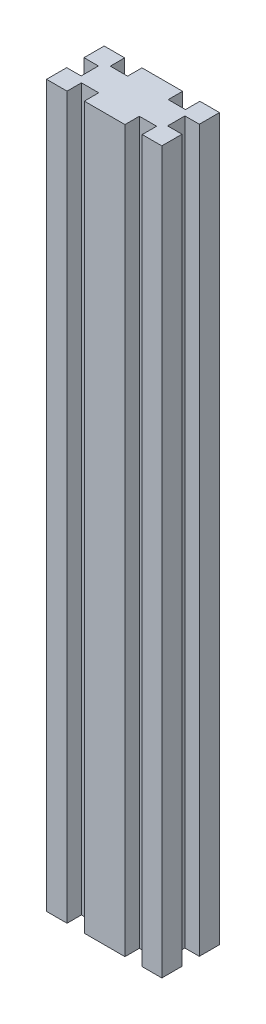
from build123d import *

# Parameters (mm, degrees)
EXTRUDE_1_DEPTH = 250


with BuildPart() as part:
    # Эскиз1 → Бобышка-Вытянуть1 (new body)
    with BuildSketch(Plane(origin=(0, 0, 0), x_dir=(1, 0, 0), z_dir=(0, 1, 0))):
        Polygon((0, 0), (7.114503097, 0), (7.114503097, 5), (13.114503097, 5), (13.114503097, 0), (27.202449332, 0), (27.202449332, 5), (33.202449332, 5), (33.202449332, 0), (40, 0), (40, 7), (35, 7), (35, 13), (40, 13), (40, 20), (33.202449332, 20), (33.202449332, 15), (27.202449332, 15), (27.202449332, 20), (13.114503097, 20), (13.114503097, 15), (7.114503097, 15), (7.114503097, 20), (0, 20), (0, 13), (5, 13), (5, 7), (0, 7), align=None)
    extrude(amount=EXTRUDE_1_DEPTH)


solid = part.part
